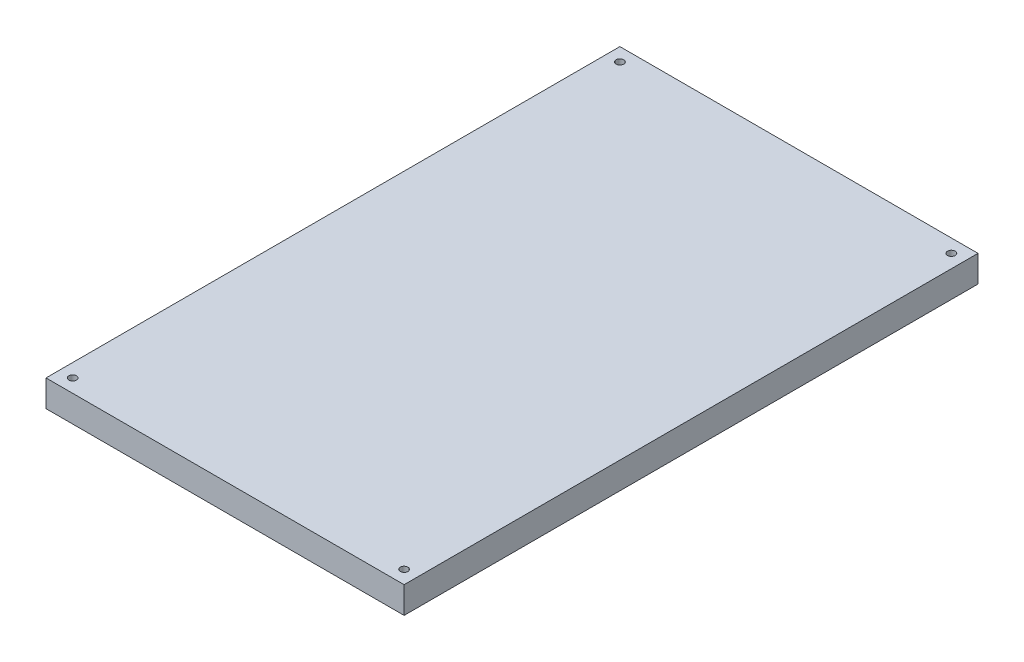
from build123d import *

# Parameters (mm, degrees)
SKETCH1_W               = 78
SKETCH1_H               = 125
BOSS_EXTRUDE1_DEPTH     = 5.8
SKETCH10_R              = 0.8299958
CUT_EXTRUDE2_DEPTH      = 74.89783488
MIRROR2_COPY_1_SKETCH_R = 0.8299958
MIRROR2_COPY_1_DEPTH    = 74.89783488


with BuildPart() as part:
    # Sketch1 → Boss-Extrude1 (new body)
    with BuildSketch(Plane(origin=(0, 25.000000038, 0), x_dir=(1, 0, 0), z_dir=(0, 1, 0))):
        Rectangle(SKETCH1_W, SKETCH1_H)
    extrude(amount=BOSS_EXTRUDE1_DEPTH)

    # Sketch10 → Cut-Extrude2 (cut, through all)
    with BuildSketch(Plane(origin=(0, 30.800000038, 0), x_dir=(1, 0, 0), z_dir=(0, 1, 0))):
        with Locations((-36.1, -59.6)):
            Circle(SKETCH10_R)
    cut_extrude2 = extrude(amount=-CUT_EXTRUDE2_DEPTH, mode=Mode.SUBTRACT)

    # Mirror1: Cut-Extrude2 across plane
    add(cut_extrude2.mirror(Plane(origin=(0, 0, 0), x_dir=(0, 0, 1), z_dir=(1, 0, 0))), mode=Mode.SUBTRACT)

    # Mirror2: Cut-Extrude2 across plane
    add(cut_extrude2.mirror(Plane.XY), mode=Mode.SUBTRACT)

    # Mirror2 copy 1 sketch → Mirror2 copy 1 (cut, through all)
    with BuildSketch(Plane(origin=(0, 30.800000038, 0), x_dir=(-1, 0, 0), z_dir=(0, 1, 0))):
        with Locations((-36.1, -59.6)):
            Circle(MIRROR2_COPY_1_SKETCH_R)
    extrude(amount=-MIRROR2_COPY_1_DEPTH, mode=Mode.SUBTRACT)


solid = part.part
